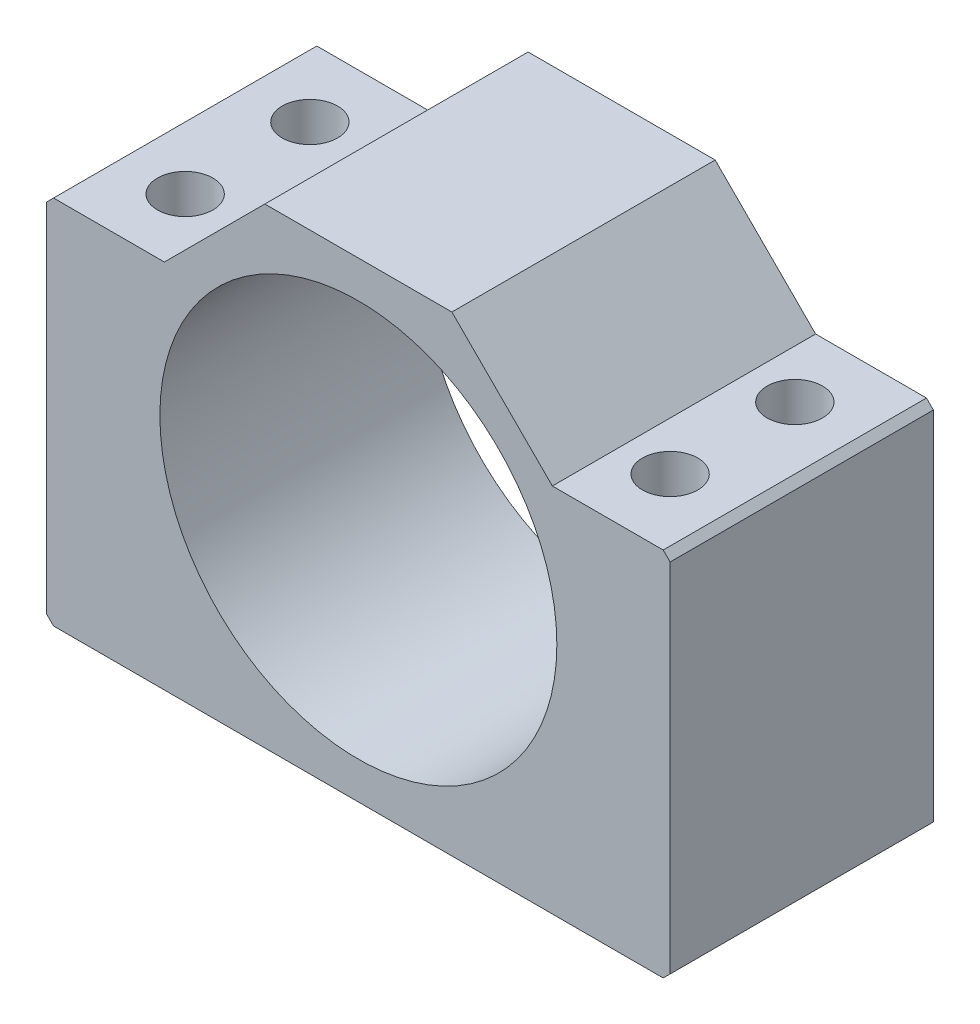
from build123d import *

# Parameters (mm, degrees)
SKETCH1_W           = 90
SKETCH1_H           = 68
SKETCH1_R           = 28.65
BOSS_EXTRUDE1_DEPTH = 19
SKETCH2_R           = 4
CUT_EXTRUDE1_DEPTH  = 84.725742756
CUT_EXTRUDE2_DEPTH  = 69.007352544
CHAMFER1_SIZE       = 1


with BuildPart() as part:
    # Sketch1 → Boss-Extrude1 (new, symmetric)
    with BuildSketch(Plane.XY):
        Rectangle(SKETCH1_W, SKETCH1_H)
        Circle(SKETCH1_R, mode=Mode.SUBTRACT)
    extrude(amount=BOSS_EXTRUDE1_DEPTH, both=True)

    # Sketch2 → Cut-Extrude1 (cut, through all)
    with BuildSketch(Plane(origin=(0, 34, 0), x_dir=(1, 0, 0), z_dir=(0, 1, 0))):
        with Locations((-35, 9)):
            Circle(SKETCH2_R)
        with Locations((-35, -9)):
            Circle(SKETCH2_R)
        with Locations((35, 9)):
            Circle(SKETCH2_R)
        with Locations((35, -9)):
            Circle(SKETCH2_R)
    extrude(amount=-CUT_EXTRUDE1_DEPTH, mode=Mode.SUBTRACT)

    # Sketch3 → Cut-Extrude2 (cut, through all)
    with BuildSketch(Plane.XY.offset(19)):
        Polygon((-45, 19.5), (-28, 19.5), (-13.5, 34), (-45, 34), align=None)
        Polygon((45, 19.5), (28, 19.5), (13.5, 34), (45, 34), align=None)
    extrude(amount=-CUT_EXTRUDE2_DEPTH, mode=Mode.SUBTRACT)

    # Chamfer1
    chamfer1_edges = [part.edges().sort_by_distance(p)[0] for p in [
        (-45, 19.5, 0),
        (45, 19.5, 0),
        (45, -34, 0),
        (-45, -34, 0),
    ]]
    chamfer(chamfer1_edges, length=CHAMFER1_SIZE)


solid = part.part
